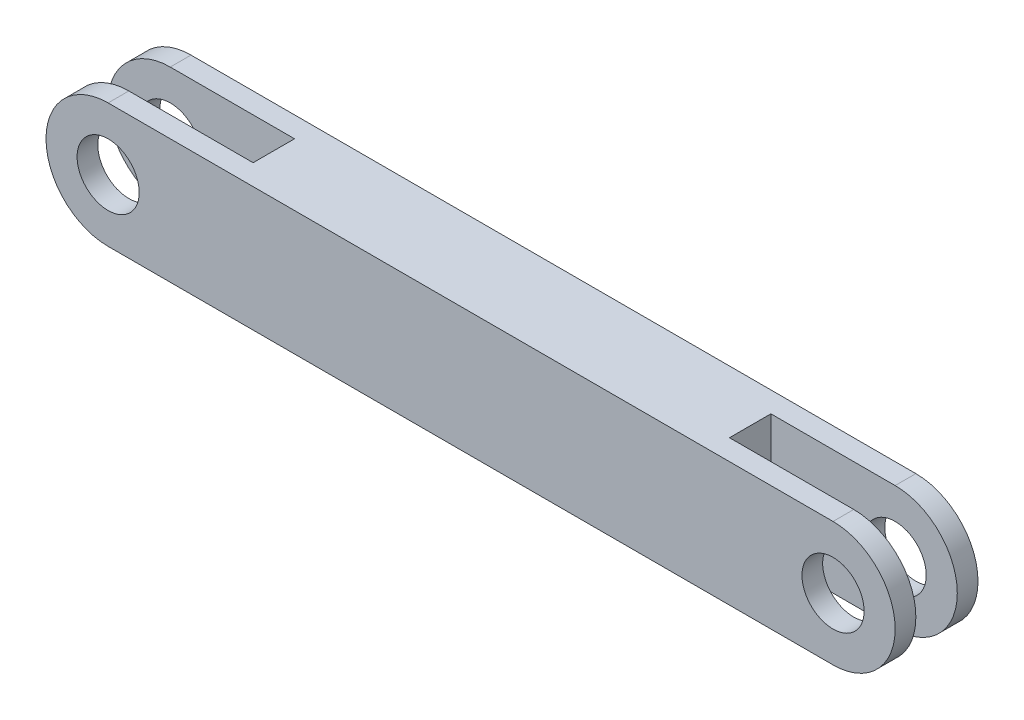
from build123d import *

# Parameters (mm, degrees)
SKETCH_1_R          = 3
EXTRUDE_1_DEPTH     = 8
SKETCH_2_W          = 18
SKETCH_2_H          = 4
CUT_EXTRUDE_1_DEPTH = 44.462627624


with BuildPart() as part:
    # 草图1 → 凸台-拉伸1 (new body)
    with BuildSketch(Plane.XY):
        with BuildLine():
            Line((-35, 6), (35, 6))
            ThreePointArc((35, 6), (41, 0), (35, -6))
            Line((35, -6), (-35, -6))
            ThreePointArc((-35, -6), (-41, 0), (-35, 6))
        make_face()
        with Locations((-35, 0)):
            Circle(SKETCH_1_R, mode=Mode.SUBTRACT)
        with Locations((35, 0)):
            Circle(SKETCH_1_R, mode=Mode.SUBTRACT)
    extrude(amount=EXTRUDE_1_DEPTH)

    # 草图2 → 切除-拉伸1 (cut, through all)
    with BuildSketch(Plane(origin=(0, 6, 0), x_dir=(1, 0, 0), z_dir=(0, 1, 0))):
        with Locations((-32, -4)):
            Rectangle(SKETCH_2_W, SKETCH_2_H)
        with Locations((32, -4)):
            Rectangle(SKETCH_2_W, SKETCH_2_H)
    extrude(amount=-CUT_EXTRUDE_1_DEPTH, mode=Mode.SUBTRACT)


solid = part.part
